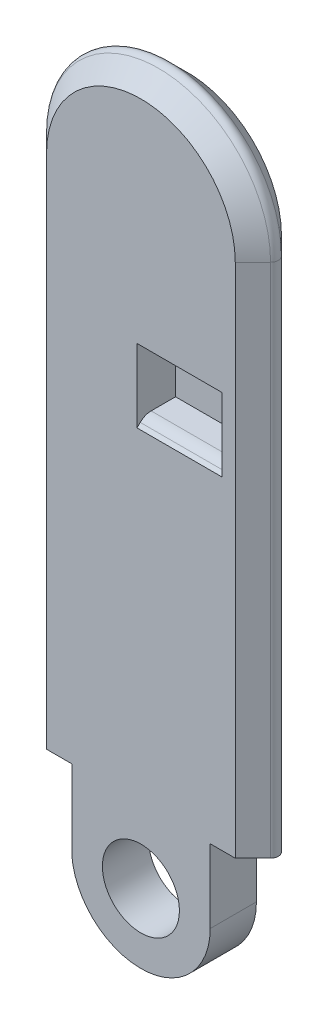
from build123d import *

# Parameters (mm, degrees)
DODANIE_WYCI_GNI_CIE1_DEPTH = 6
SFAZOWANIE1_SIZE            = 3.5
ZAOKR_GLENIE1_R             = 1
SZKIC2_W                    = 11
SZKIC2_H                    = 5.5
WYTNIJ_WYCI_GNI_CIE1_DEPTH  = 5
SZKIC3_W                    = 9
SZKIC3_H                    = 6.5
WYTNIJ_WYCI_GNI_CIE2_DEPTH  = 4.5
SFAZOWANIE2_SIZE            = 0.5
SZKIC4_R                    = 5
DODANIE_WYCI_GNI_CIE2_DEPTH = 6
SZKIC5_W                    = 4
SZKIC5_H                    = 6
DODANIE_WYCI_GNI_CIE3_DEPTH = 4.5
SFAZOWANIE3_SIZE            = 3
SFAZOWANIE4_SIZE            = 1
ZAOKR_GLENIE2_R             = 2


with BuildPart() as part:
    # Szkic1 → Dodanie-wyciągnięcie1 (new body)
    with BuildSketch(Plane.XY):
        with BuildLine():
            ThreePointArc((15.75, 33.5), (0, 49.25), (-15.75, 33.5))
            Line((-15.75, 33.5), (15.75, 33.5))
        make_face()
        with BuildLine():
            Line((15.75, 33.5), (-15.75, 33.5))
            ThreePointArc((-15.75, 33.5), (0, 17.75), (15.75, 33.5))
        make_face()
        with BuildLine():
            ThreePointArc((15.75, 33.5), (0, 17.75), (-15.75, 33.5))
            Line((-15.75, 33.5), (-15.75, -33.5))
            Line((-15.75, -33.5), (15.75, -33.5))
            Line((15.75, -33.5), (15.75, 33.5))
        make_face()
    extrude(amount=-DODANIE_WYCI_GNI_CIE1_DEPTH)

    # Sfazowanie1
    # the kernel refuses this chamfer: 3.5 mm, written as the material it takes off along each edge
    with BuildSketch(Plane(origin=(15.75, -42.500890458, 0), x_dir=(-0.9996219169112968, 0, 0.02749587661058637), z_dir=(0, 1, 0)), Plane(origin=(-15.75, 33.5, 0), x_dir=(0.9996219169112968, 0, 0.02749587661058637), z_dir=(0, -1, 0)), Plane(origin=(-15.75, 33.5, -6), x_dir=(-0.02749587661058661, 0, 0.9996219169112968), z_dir=(0, -1, 0))) as sfazowanie1_piece_1:
        Polygon((SFAZOWANIE1_SIZE * 0.999621916911, -SFAZOWANIE1_SIZE * 0.0274958766106), (-SFAZOWANIE1_SIZE * 0.0274958766106, -SFAZOWANIE1_SIZE * 0.999621916911), (0, 0), align=None)
    extrude(amount=76.000890458, mode=Mode.SUBTRACT)
    with BuildSketch(Plane(origin=(15.75, -42.500890458, -6), x_dir=(-0.9996219169112968, 0, -0.027495876610586358), z_dir=(0, 1, 0))) as sfazowanie1_piece_2:
        Polygon((SFAZOWANIE1_SIZE * 0.999621916911, SFAZOWANIE1_SIZE * 0.0274958766106), (-SFAZOWANIE1_SIZE * 0.0274958766106, SFAZOWANIE1_SIZE * 0.999621916911), (0, 0), align=None)
    extrude(amount=76.000890458, mode=Mode.SUBTRACT)
    with BuildSketch(Plane(origin=(0, 33.5, 0), x_dir=(-1, 0, 0), z_dir=(0, -1, 0))) as sfazowanie1_piece_3:
        Polygon((15.75, SFAZOWANIE1_SIZE), (15.75 - SFAZOWANIE1_SIZE, 0), (15.75, 0), align=None)
    revolve(axis=Axis((0, 33.5, 0), (0, 0, -1)), revolution_arc=180, mode=Mode.SUBTRACT)
    with BuildSketch(Plane(origin=(0, 33.5, -6), x_dir=(1, 0, 0), z_dir=(0, -1, 0))) as sfazowanie1_piece_4:
        Polygon((15.75, SFAZOWANIE1_SIZE), (15.75 - SFAZOWANIE1_SIZE, 0), (15.75, 0), align=None)
    revolve(axis=Axis((0, 33.5, -6), (0, 0, 1)), revolution_arc=180, mode=Mode.SUBTRACT)

    # Zaokrąglenie1
    zaokr_glenie1_edges = [part.edges().sort_by_distance(p)[0] for p in [
        (-15.25, 0, -3),
        (0, 48.75, -3),
        (15.25, 0, -3),
    ]]
    fillet(zaokr_glenie1_edges, radius=ZAOKR_GLENIE1_R)

    # Szkic2 → Wytnij-wyciągnięcie1 (cut)
    with BuildSketch(Plane.XY):
        with Locations((5, 12.25)):
            Rectangle(SZKIC2_W, SZKIC2_H)
    extrude(amount=-WYTNIJ_WYCI_GNI_CIE1_DEPTH, mode=Mode.SUBTRACT)

    # Szkic3 → Wytnij-wyciągnięcie2 (cut)
    with BuildSketch(Plane(origin=(0, 0, -6), x_dir=(-1, 0, 0), z_dir=(0, 0, -1))):
        with Locations((6, -27.988867336)):
            Rectangle(SZKIC3_W, SZKIC3_H)
    extrude(amount=-WYTNIJ_WYCI_GNI_CIE2_DEPTH, mode=Mode.SUBTRACT)

    # Sfazowanie2
    sfazowanie2_edges = [part.edges().sort_by_distance(p)[0] for p in [
        (-6, -24.738867336, -6),
    ]]
    chamfer(sfazowanie2_edges, length=SFAZOWANIE2_SIZE)

    # Szkic4 → Dodanie-wyciągnięcie2 (add)
    with BuildSketch(Plane.XY):
        with BuildLine():
            Line((9, -33.5), (-8.974684649, -33.5))
            Line((-8.974684649, -33.5), (-8.974684649, -43.705386779))
            ThreePointArc((-8.974684649, -43.705386779), (0.337519003, -52.024492564), (9, -43.030823629))
            Line((9, -43.030823629), (9, -33.5))
        make_face()
        with Locations((0, -43.030823629)):
            Circle(SZKIC4_R, mode=Mode.SUBTRACT)
    extrude(amount=-DODANIE_WYCI_GNI_CIE2_DEPTH)

    # Szkic5 → Dodanie-wyciągnięcie3 (add)
    with BuildSketch(Plane(origin=(0, 0, -6), x_dir=(-1, 0, 0), z_dir=(0, 0, -1))):
        with Locations((-2.5, 12)):
            Rectangle(SZKIC5_W, SZKIC5_H)
    extrude(amount=DODANIE_WYCI_GNI_CIE3_DEPTH)

    # Sfazowanie3
    sfazowanie3_edges = [part.edges().sort_by_distance(p)[0] for p in [
        (5, 15, 0),
    ]]
    chamfer(sfazowanie3_edges, length=SFAZOWANIE3_SIZE)

    # Sfazowanie4
    sfazowanie4_edges = [part.edges().sort_by_distance(p)[0] for p in [
        (5, 9.5, 0),
    ]]
    chamfer(sfazowanie4_edges, length=SFAZOWANIE4_SIZE)

    # Zaokrąglenie2
    zaokr_glenie2_edges = [part.edges().sort_by_distance(p)[0] for p in [
        (5, 9.5, -1),
    ]]
    fillet(zaokr_glenie2_edges, radius=ZAOKR_GLENIE2_R)


solid = part.part
